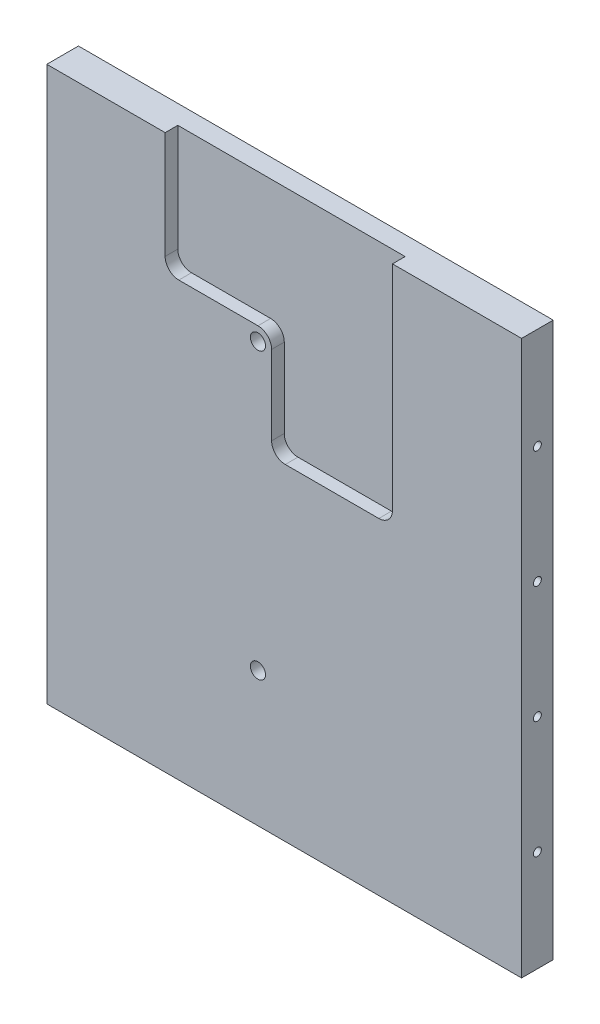
from build123d import *

# Parameters (mm, degrees)
SKIZZE1_W                       = 150
SKIZZE1_H                       = 175
AUFSATZ_LINEAR_AUSTRAGEN1_DEPTH = 10
SKIZZE2_R                       = 2.3876
SCHNITT_LINEAR_AUSTRAGEN1_DEPTH = 10
SCHNITT_LINEAR_AUSTRAGEN2_DEPTH = 4
SKIZZE4_R                       = 1.25
SCHNITT_LINEAR_AUSTRAGEN3_DEPTH = 5
SCHNITT_LINEAR_START            = -5
SKIZZE6_R                       = 1.25
SCHNITT_LINEAR_AUSTRAGEN4_DEPTH = 5


with BuildPart() as part:
    # Skizze1 → Aufsatz-Linear austragen1 (new body)
    with BuildSketch(Plane.XY):
        with Locations((-21.140947697, -18.099765847)):
            Rectangle(SKIZZE1_W, SKIZZE1_H)
    extrude(amount=AUFSATZ_LINEAR_AUSTRAGEN1_DEPTH)

    # Skizze2 → Schnitt-Linear austragen1 (cut)
    with BuildSketch(Plane.XY.offset(10)):
        with Locations((-29.425704113, 26.900234153)):
            Circle(SKIZZE2_R)
        with Locations((-29.425704113, -63.099765847)):
            Circle(SKIZZE2_R)
    extrude(amount=-SCHNITT_LINEAR_AUSTRAGEN1_DEPTH, mode=Mode.SUBTRACT)

    # Skizze3 → Schnitt-Linear austragen2 (cut)
    with BuildSketch(Plane.XY.offset(10)):
        with BuildLine():
            Line((-54.425704113, 31.218234153), (-29.425704113, 31.218234153))
            ThreePointArc((-29.425704113, 31.218234153), (-26.372417032, 29.953521235), (-25.107704113, 26.900234153))
            Line((-25.107704113, 26.900234153), (-25.107704113, 1.900234153))
            ThreePointArc((-25.107704113, 1.900234153), (-23.842991195, -1.153052928), (-20.789704113, -2.417765847))
            Line((-20.789704113, -2.417765847), (8.756295887, -2.417765847))
            ThreePointArc((8.756295887, -2.417765847), (11.809582968, -1.153052928), (13.074295887, 1.900234153))
            Line((13.074295887, 1.900234153), (13.074295887, 69.400234153))
            Line((13.074295887, 69.400234153), (-58.743704113, 69.400234153))
            Line((-58.743704113, 69.400234153), (-58.743704113, 35.536234153))
            ThreePointArc((-58.743704113, 35.536234153), (-57.478991195, 32.482947072), (-54.425704113, 31.218234153))
        make_face()
    extrude(amount=-SCHNITT_LINEAR_AUSTRAGEN2_DEPTH, mode=Mode.SUBTRACT)

    # Skizze4 → Schnitt-Linear austragen3 (cut)
    with BuildSketch(Plane.ZY.offset(96.140947697)):
        with Locations((5, 37.400234153)):
            Circle(SKIZZE4_R)
        with Locations((5, 0.400234153)):
            Circle(SKIZZE4_R)
        with Locations((5, -36.599765847)):
            Circle(SKIZZE4_R)
        with Locations((5, -73.599765847)):
            Circle(SKIZZE4_R)
    extrude(amount=-SCHNITT_LINEAR_AUSTRAGEN3_DEPTH, mode=Mode.SUBTRACT)

    # Skizze6 → Schnitt-Linear austragen4 (cut)
    with BuildSketch(Plane(origin=(53.859052303, 0, 0), x_dir=(0, 0, -1), z_dir=(1, 0, 0)).offset(SCHNITT_LINEAR_START)):
        with Locations((-5, 37.400234153)):
            Circle(SKIZZE6_R)
        with Locations((-5, 0.400234153)):
            Circle(SKIZZE6_R)
        with Locations((-5, -36.599765847)):
            Circle(SKIZZE6_R)
        with Locations((-5, -73.599765847)):
            Circle(SKIZZE6_R)
    extrude(amount=SCHNITT_LINEAR_AUSTRAGEN4_DEPTH, mode=Mode.SUBTRACT)


solid = part.part
